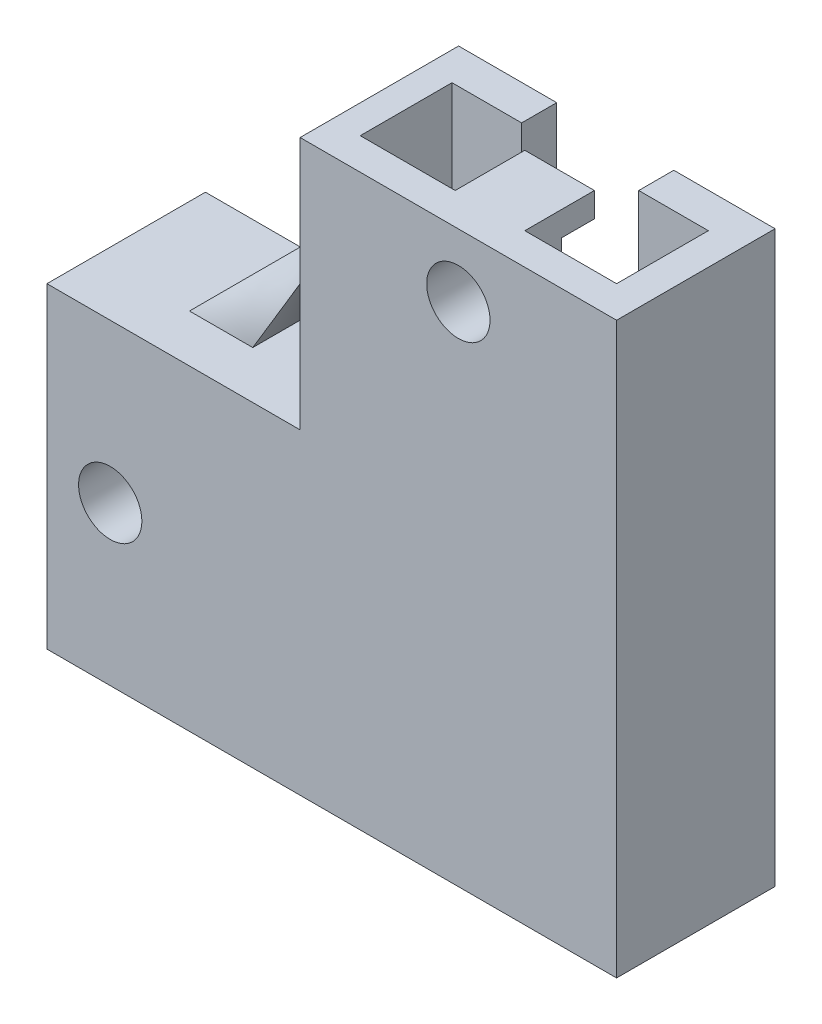
from build123d import *

# Parameters (mm, degrees)
SKETCH1_W           = 25
SKETCH1_H           = 25
BOSS_EXTRUDE1_DEPTH = 22.5
SKETCH4_W           = 25
SKETCH4_H           = 25
BOSS_EXTRUDE2_DEPTH = 20
CUT_EXTRUDE2_DEPTH  = 42.5
CUT_EXTRUDE3_DEPTH  = 21.5
SKETCH6_R           = 2.25
CUT_EXTRUDE4_DEPTH  = 10
SKETCH10_R          = 2.5
CUT_EXTRUDE7_DEPTH  = 10
CUT_EXTRUDE8_DEPTH  = 2.6
SKETCH8_W           = 45
SKETCH8_H           = 12.480087705
CUT_EXTRUDE9_DEPTH  = 50


with BuildPart() as part:
    # Sketch1 → Boss-Extrude1 (new, symmetric)
    with BuildSketch(Plane(origin=(0, 0, 0), x_dir=(1, 0, 0), z_dir=(0, 1, 0))):
        Rectangle(SKETCH1_W, SKETCH1_H)
    extrude(amount=BOSS_EXTRUDE1_DEPTH, both=True)

    # Sketch4 → Boss-Extrude2 (add)
    with BuildSketch(Plane.ZY.offset(12.5)):
        with Locations((0, 10)):
            Rectangle(SKETCH4_W, SKETCH4_H)
    extrude(amount=BOSS_EXTRUDE2_DEPTH)

    # Sketch3 → Cut-Extrude2 (cut)
    with BuildSketch(Plane.XZ.offset(22.5)):
        Polygon((-2.75, 4.5), (-2.75, 10), (-10.25, 10), (-10.25, 2.75), (-4.75, 2.75), (-4.75, -2.75), (-10.25, -2.75), (-10.25, -10.25), (-2.75, -10.25), (-2.75, -4.75), (2.75, -4.75), (2.75, -10.25), (10, -10.25), (10, -2.75), (4.5, -2.75), (4.5, 2.75), (10, 2.75), (10, 10), (2.75, 10), (2.75, 4.5), align=None)
    extrude(amount=-CUT_EXTRUDE2_DEPTH, mode=Mode.SUBTRACT)

    # Sketch5 → Cut-Extrude3 (cut)
    with BuildSketch(Plane.ZY.offset(32.5)):
        Polygon((-10.125, 7.25), (-10.125, -0.125), (-2.75, -0.125), (-2.75, 5.375), (2.75, 5.375), (2.75, -0.125), (10.125, -0.125), (10.125, 7.25), (4.625, 7.25), (4.625, 12.75), (10.125, 12.75), (10.125, 20.125), (2.75, 20.125), (2.75, 14.625), (-2.75, 14.625), (-2.75, 20.125), (-10.125, 20.125), (-10.125, 12.75), (-4.625, 12.75), (-4.625, 7.25), align=None)
    extrude(amount=-CUT_EXTRUDE3_DEPTH, mode=Mode.SUBTRACT)

    # Sketch6 → Cut-Extrude4 (cut)
    with BuildSketch(Plane(origin=(0, 0, -12.5), x_dir=(-1, 0, 0), z_dir=(0, 0, -1))):
        with Locations((0, -12.5)):
            Circle(SKETCH6_R)
        with Locations((22.5, 10)):
            Circle(SKETCH6_R)
    extrude(amount=-CUT_EXTRUDE4_DEPTH, mode=Mode.SUBTRACT)

    # Sketch10 → Cut-Extrude7 (cut)
    with BuildSketch(Plane.XY.offset(12.5)):
        with Locations((-27.5, 10)):
            Circle(SKETCH10_R)
        with Locations((0, -17.5)):
            Circle(SKETCH10_R)
    extrude(amount=-CUT_EXTRUDE7_DEPTH, mode=Mode.SUBTRACT)

    # Sketch11 → Cut-Extrude8 (cut)
    with BuildSketch(Plane(origin=(0, 0, 4.5), x_dir=(-1, 0, 0), z_dir=(0, 0, -1))):
        Polygon((2.222626661, -13.550219745), (-2.309296709, -13.600258721), (-4.53192337, -17.550038976), (-2.222626661, -21.449780255), (2.309296709, -21.399741279), (4.53192337, -17.449961024), align=None)
        Polygon((31.412394942, 12.287793512), (27.474910171, 14.532130165), (23.562515229, 12.244336654), (23.587605058, 7.712206488), (27.525089829, 5.467869835), (31.437484771, 7.755663346), align=None)
    extrude(amount=-CUT_EXTRUDE8_DEPTH, mode=Mode.SUBTRACT)

    # Sketch8 → Cut-Extrude9 (cut)
    with BuildSketch(Plane(origin=(0, 22.5, 0), x_dir=(1, 0, 0), z_dir=(0, 1, 0))):
        with Locations((-10, 6.259956147)):
            Rectangle(SKETCH8_W, SKETCH8_H)
    extrude(amount=-CUT_EXTRUDE9_DEPTH, mode=Mode.SUBTRACT)

    # Loft1: read off the stored shape, not the designer's step
    # Loft1: loft between two sections, ruled curve by curve
    loft1_from = [
        Edge.make_bspline([(-20, -2.5, 8.740043853), (-20.833333333, -2.5, 8.740043853), (-21.666666667, -2.5, 8.740043853), (-23.333333333, -2.5, 8.740043853), (-24.166666667, -2.5, 8.740043853), (-25, -2.5, 8.740043853)], [0, 0, 0, 0, 0.5, 0.5, 1, 1, 1, 1], 3),
        Edge.make_bspline([(-25, -2.5, 8.740043853), (-25, -2.5, 7.906710519), (-25, -2.5, 7.073377186), (-25, -2.5, 5.406710519), (-25, -2.5, 4.573377186), (-25, -2.5, 3.740043853)], [0, 0, 0, 0, 0.5, 0.5, 1, 1, 1, 1], 3),
        Edge.make_bspline([(-20, -2.5, 3.740043853), (-20, -2.5, 4.573377186), (-20, -2.5, 5.406710519), (-20, -2.5, 7.073377186), (-20, -2.5, 7.906710519), (-20, -2.5, 8.740043853)], [0, 0, 0, 0, 0.5, 0.5, 1, 1, 1, 1], 3),
        Edge.make_bspline([(-25, -2.5, 3.740043853), (-24.166666667, -2.5, 3.740043853), (-23.333333333, -2.5, 3.740043853), (-21.666666667, -2.5, 3.740043853), (-20.833333333, -2.5, 3.740043853), (-20, -2.5, 3.740043853)], [0, 0, 0, 0, 0.5, 0.5, 1, 1, 1, 1], 3),
    ]
    loft1_to = [
        Edge.make_bspline([(-12.5, -15, 8.740043853), (-12.5, -15, 7.906710519), (-12.5, -15, 7.073377186), (-12.5, -15, 5.406710519), (-12.5, -15, 4.573377186), (-12.5, -15, 3.740043853)], [0, 0, 0, 0, 0.5, 0.5, 1, 1, 1, 1], 3),
        Edge.make_bspline([(-12.5, -15, 3.740043853), (-12.5, -14.166666667, 3.740043853), (-12.5, -13.333333333, 3.740043853), (-12.5, -11.666666667, 3.740043853), (-12.5, -10.833333333, 3.740043853), (-12.5, -10, 3.740043853)], [0, 0, 0, 0, 0.5, 0.5, 1, 1, 1, 1], 3),
        Edge.make_bspline([(-12.5, -10, 8.740043853), (-12.5, -10.833333333, 8.740043853), (-12.5, -11.666666667, 8.740043853), (-12.5, -13.333333333, 8.740043853), (-12.5, -14.166666667, 8.740043853), (-12.5, -15, 8.740043853)], [0, 0, 0, 0, 0.5, 0.5, 1, 1, 1, 1], 3),
        Edge.make_bspline([(-12.5, -10, 3.740043853), (-12.5, -10, 4.573377186), (-12.5, -10, 5.406710519), (-12.5, -10, 7.073377186), (-12.5, -10, 7.906710519), (-12.5, -10, 8.740043853)], [0, 0, 0, 0, 0.5, 0.5, 1, 1, 1, 1], 3),
    ]
    loft1 = Solid(Shell([*[Face.make_surface_from_curves(loft1_from[k], loft1_to[k]) for k in range(4)], Face(Wire(loft1_from)), Face(Wire(loft1_to))]))
    add(loft1)


with BuildPart() as body_2:
    # Mirror1: mirrored copy
    add(part.part.mirror(Plane(origin=(0, 22.5, 0), x_dir=(0, 0, 1), z_dir=(0, -1, 0))))


solid = body_2.part
